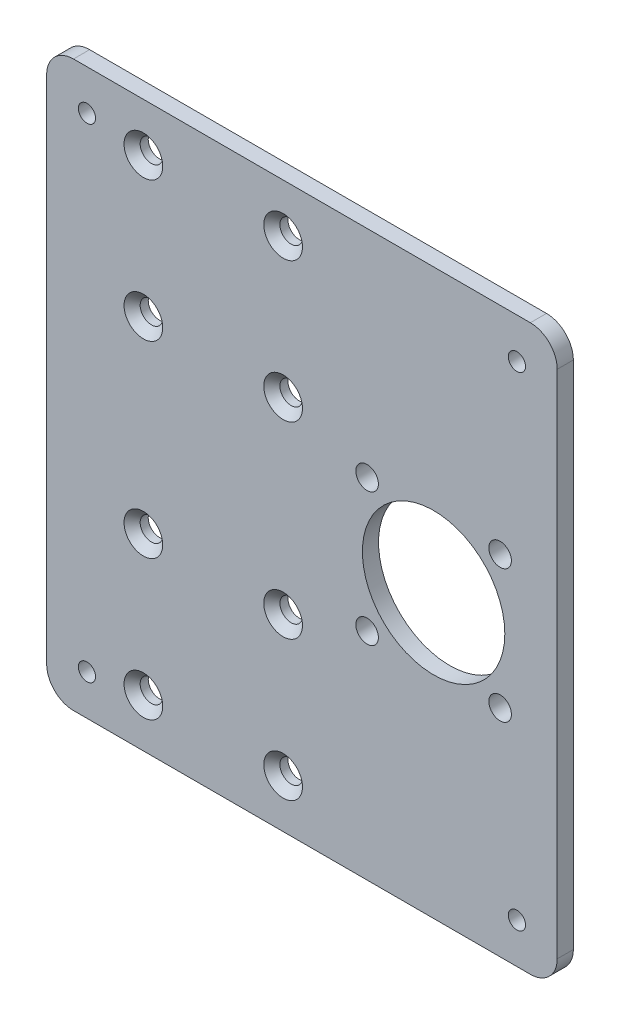
from build123d import *

# Parameters (mm, degrees)
SKETCH_2_W      = 95
SKETCH_2_H      = 105
SKETCH_2_R      = 2.1
SKETCH_2_R_2    = 13.25
SKETCH_2_R_3    = 1.6
EXTRUDE_1_DEPTH = 3
FILLET_1_R      = 5
CHAMFER_1_SIZE  = 1.5


with BuildPart() as part:
    # ｽｹｯﾁ2 → ﾎﾞｽ - 押し出し1 (new body)
    with BuildSketch(Plane.XY):
        with Locations((16.5, 0)):
            Rectangle(SKETCH_2_W, SKETCH_2_H)
        with Locations((-13, -17.5)):
            Circle(SKETCH_2_R, mode=Mode.SUBTRACT)
        with Locations((-13, -43.5)):
            Circle(SKETCH_2_R, mode=Mode.SUBTRACT)
        with Locations((13, -17.5)):
            Circle(SKETCH_2_R, mode=Mode.SUBTRACT)
        with Locations((13, -43.5)):
            Circle(SKETCH_2_R, mode=Mode.SUBTRACT)
        with Locations((41, 0)):
            Circle(SKETCH_2_R_2, mode=Mode.SUBTRACT)
        with Locations((53.374368671, 12.374368671)):
            Circle(SKETCH_2_R, mode=Mode.SUBTRACT)
        with Locations((28.625631329, -12.374368671)):
            Circle(SKETCH_2_R, mode=Mode.SUBTRACT)
        with Locations((53.374368671, -12.374368671)):
            Circle(SKETCH_2_R, mode=Mode.SUBTRACT)
        with Locations((28.625631329, 12.374368671)):
            Circle(SKETCH_2_R, mode=Mode.SUBTRACT)
        with Locations((-23.5, 45)):
            Circle(SKETCH_2_R_3, mode=Mode.SUBTRACT)
        with Locations((-23.5, -45)):
            Circle(SKETCH_2_R_3, mode=Mode.SUBTRACT)
        with Locations((56.5, -45)):
            Circle(SKETCH_2_R_3, mode=Mode.SUBTRACT)
        with Locations((56.5, 45)):
            Circle(SKETCH_2_R_3, mode=Mode.SUBTRACT)
        with Locations((-13, 17.5)):
            Circle(SKETCH_2_R, mode=Mode.SUBTRACT)
        with Locations((13, 17.5)):
            Circle(SKETCH_2_R, mode=Mode.SUBTRACT)
        with Locations((13, 43.5)):
            Circle(SKETCH_2_R, mode=Mode.SUBTRACT)
        with Locations((-13, 43.5)):
            Circle(SKETCH_2_R, mode=Mode.SUBTRACT)
    extrude(amount=EXTRUDE_1_DEPTH)

    # ﾌｨﾚｯﾄ1
    fillet_1_edges = [part.edges().sort_by_distance(p)[0] for p in [
        (-31, -52.5, 1.5),
        (64, -52.5, 1.5),
        (-31, 52.5, 1.5),
        (64, 52.5, 1.5),
    ]]
    fillet(fillet_1_edges, radius=FILLET_1_R)

    # 面取り1
    chamfer_1_edges = [part.edges().sort_by_distance(p)[0] for p in [
        (10.9, 43.5, 3),
        (-15.1, 43.5, 3),
        (-15.1, 17.5, 3),
        (10.9, 17.5, 3),
        (-15.1, -17.5, 3),
        (10.9, -17.5, 3),
        (10.9, -43.5, 3),
        (-15.1, -43.5, 3),
    ]]
    chamfer(chamfer_1_edges, length=CHAMFER_1_SIZE)


solid = part.part
